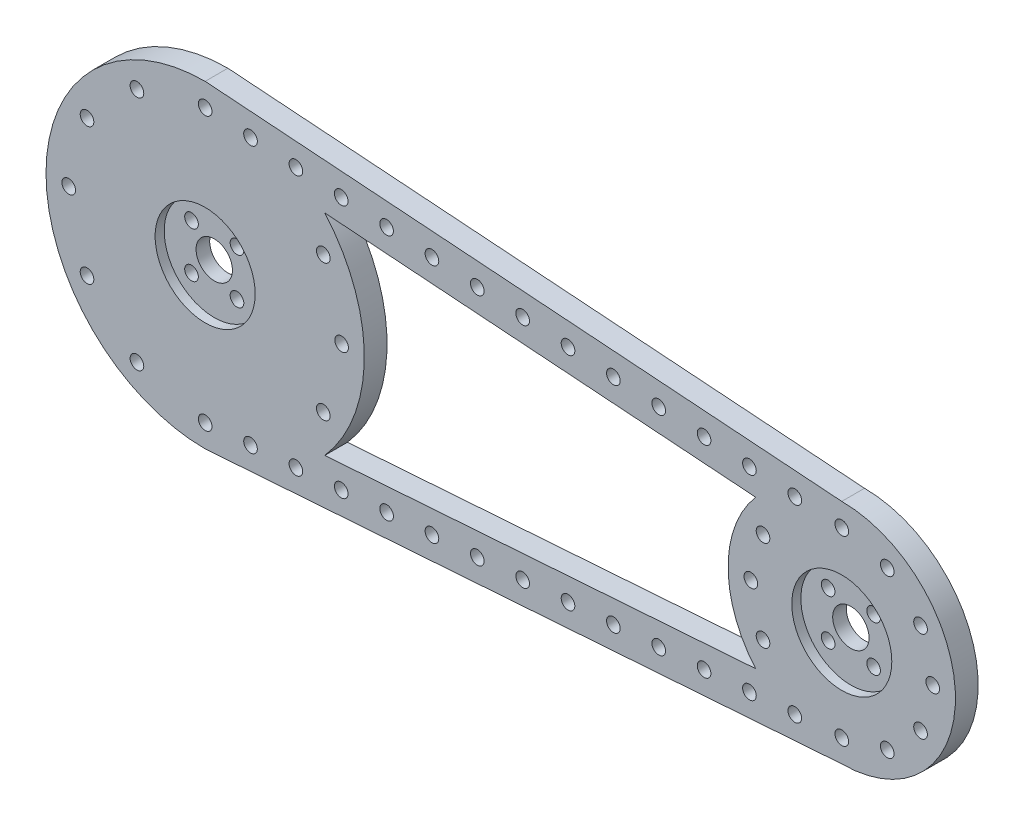
from build123d import *

# Parameters (mm, degrees)
EXTRUDE_3_DEPTH     = 5
SKETCH_4_R          = 1.5
SKETCH_4_R_2        = 4
CUT_EXTRUDE_3_DEPTH = 5
SKETCH_5_R          = 11
CUT_EXTRUDE_4_DEPTH = 2
SKETCH_6_R          = 1.5
CUT_EXTRUDE_6_DEPTH = 169.745370307
SKETCH_8_R          = 1.5
CUT_EXTRUDE_8_DEPTH = 169.745370307
SKETCH_9_R          = 1.5
EXTRUDE_4_DEPTH     = 5
SKETCH_10_R         = 1.5
EXTRUDE_6_DEPTH     = 5


with BuildPart() as part:
    # 草图1 → 凸台-拉伸3 (new body)
    with BuildSketch(Plane.XY):
        with BuildLine():
            Line((140, 25), (0, 35))
            ThreePointArc((0, 35), (-35, 0), (0, -35))
            Line((0, -35), (140, -25))
            ThreePointArc((140, -25), (165, 0), (140, 25))
        make_face()
    extrude(amount=EXTRUDE_3_DEPTH)

    # 草图4 → 切除-拉伸3 (cut)
    with BuildSketch(Plane.XY.offset(5)):
        with Locations((-5, -5)):
            Circle(SKETCH_4_R)
        with Locations((5, -5)):
            Circle(SKETCH_4_R)
        with Locations((-5, 5)):
            Circle(SKETCH_4_R)
        with Locations((5, 5)):
            Circle(SKETCH_4_R)
        with Locations((135, -5)):
            Circle(SKETCH_4_R)
        with Locations((145, -5)):
            Circle(SKETCH_4_R)
        with Locations((135, 5)):
            Circle(SKETCH_4_R)
        with Locations((145, 5)):
            Circle(SKETCH_4_R)
        Circle(SKETCH_4_R_2)
        with Locations((140, 0)):
            Circle(SKETCH_4_R_2)
    extrude(amount=-CUT_EXTRUDE_3_DEPTH, mode=Mode.SUBTRACT)

    # 草图5 → 切除-拉伸4 (cut)
    with BuildSketch(Plane.XY.offset(5)):
        Circle(SKETCH_5_R)
        with Locations((140, 0)):
            Circle(SKETCH_5_R)
    extrude(amount=-CUT_EXTRUDE_4_DEPTH, mode=Mode.SUBTRACT)

    # 草图6 → 切除-拉伸6 (cut, through all)
    with BuildSketch(Plane.XY.offset(5)):
        with Locations((30, 0)):
            Circle(SKETCH_6_R)
        with Locations((25.980762114, 15)):
            Circle(SKETCH_6_R)
        with Locations((25.980762114, -15)):
            Circle(SKETCH_6_R)
        with Locations((15, 25.980762114)):
            Circle(SKETCH_6_R)
        with Locations((15, -25.980762114)):
            Circle(SKETCH_6_R)
        with Locations((0, 30)):
            Circle(SKETCH_6_R)
        with Locations((0, -30)):
            Circle(SKETCH_6_R)
        with Locations((-15, 25.980762114)):
            Circle(SKETCH_6_R)
        with Locations((-15, -25.980762114)):
            Circle(SKETCH_6_R)
        with Locations((-25.980762114, 15)):
            Circle(SKETCH_6_R)
        with Locations((-25.980762114, -15)):
            Circle(SKETCH_6_R)
        with Locations((-30, 0)):
            Circle(SKETCH_6_R)
        with Locations((160, 0)):
            Circle(SKETCH_6_R)
        with Locations((157.320508076, 10)):
            Circle(SKETCH_6_R)
        with Locations((157.320508076, -10)):
            Circle(SKETCH_6_R)
        with Locations((150, 17.320508076)):
            Circle(SKETCH_6_R)
        with Locations((150, -17.320508076)):
            Circle(SKETCH_6_R)
        with Locations((140, 20)):
            Circle(SKETCH_6_R)
        with Locations((140, -20)):
            Circle(SKETCH_6_R)
        with Locations((130, 17.320508076)):
            Circle(SKETCH_6_R)
        with Locations((130, -17.320508076)):
            Circle(SKETCH_6_R)
        with Locations((122.679491924, 10)):
            Circle(SKETCH_6_R)
        with Locations((122.679491924, -10)):
            Circle(SKETCH_6_R)
        with Locations((120, 0)):
            Circle(SKETCH_6_R)
    extrude(amount=-CUT_EXTRUDE_6_DEPTH, mode=Mode.SUBTRACT)

    # 草图8 → 切除-拉伸8 (cut, through all)
    with BuildSketch(Plane.XY.offset(5)):
        with Locations((9.974586998, -29.2875295)):
            Circle(SKETCH_8_R)
        with Locations((19.949173997, -28.575059)):
            Circle(SKETCH_8_R)
        with Locations((9.974586998, 29.2875295)):
            Circle(SKETCH_8_R)
        with BuildLine():
            ThreePointArc((26.297708958, 23.096114469), (35, 0), (26.297708958, -23.096114469))
            Line((26.297708958, -23.096114469), (121.06763386, -16.326834119))
            ThreePointArc((121.06763386, -16.326834119), (115, 0), (121.06763386, 16.326834119))
            Line((121.06763386, 16.326834119), (26.297708958, 23.096114469))
        make_face()
        with Locations((19.949173997, 28.575059)):
            Circle(SKETCH_8_R)
        with Locations((29.923760995, -27.8625885)):
            Circle(SKETCH_8_R)
        with Locations((39.898347993, -27.150118)):
            Circle(SKETCH_8_R)
        with Locations((119.69504398, -21.450354001)):
            Circle(SKETCH_8_R)
        with Locations((129.669630978, -20.737883502)):
            Circle(SKETCH_8_R)
        with Locations((29.923760995, 27.8625885)):
            Circle(SKETCH_8_R)
        with Locations((129.669630978, 20.737883502)):
            Circle(SKETCH_8_R)
        with Locations((119.69504398, 21.450354001)):
            Circle(SKETCH_8_R)
        with Locations((49.872934992, -26.437647501)):
            Circle(SKETCH_8_R)
        with Locations((109.720456981, -22.162824501)):
            Circle(SKETCH_8_R)
        with Locations((39.898347993, 27.150118)):
            Circle(SKETCH_8_R)
        with Locations((109.720456981, 22.162824501)):
            Circle(SKETCH_8_R)
        with Locations((59.84752199, -25.725177001)):
            Circle(SKETCH_8_R)
        with Locations((99.745869983, -22.875295001)):
            Circle(SKETCH_8_R)
        with Locations((49.872934992, 26.437647501)):
            Circle(SKETCH_8_R)
        with Locations((99.745869983, 22.875295001)):
            Circle(SKETCH_8_R)
        with Locations((69.822108988, -25.012706501)):
            Circle(SKETCH_8_R)
        with Locations((89.771282985, -23.587765501)):
            Circle(SKETCH_8_R)
        with Locations((59.84752199, 25.725177001)):
            Circle(SKETCH_8_R)
        with Locations((89.771282985, 23.587765501)):
            Circle(SKETCH_8_R)
        with Locations((79.796695986, -24.300236001)):
            Circle(SKETCH_8_R)
        with Locations((69.822108988, 25.012706501)):
            Circle(SKETCH_8_R)
        with Locations((79.796695986, 24.300236001)):
            Circle(SKETCH_8_R)
    extrude(amount=-CUT_EXTRUDE_8_DEPTH, mode=Mode.SUBTRACT)

    # 草图9 → 凸台-拉伸4 (add)
    with BuildSketch(Plane.XY.offset(5)):
        with Locations((15, 25.980762114)):
            Circle(SKETCH_9_R)
        with Locations((15, -25.980762114)):
            Circle(SKETCH_9_R)
    extrude(amount=-EXTRUDE_4_DEPTH)

    # 草图10 → 凸台-拉伸6 (add)
    with BuildSketch(Plane.XY.offset(5)):
        with Locations((130, -17.320508076)):
            Circle(SKETCH_10_R)
        with Locations((130, 17.320508076)):
            Circle(SKETCH_10_R)
    extrude(amount=-EXTRUDE_6_DEPTH)


solid = part.part
